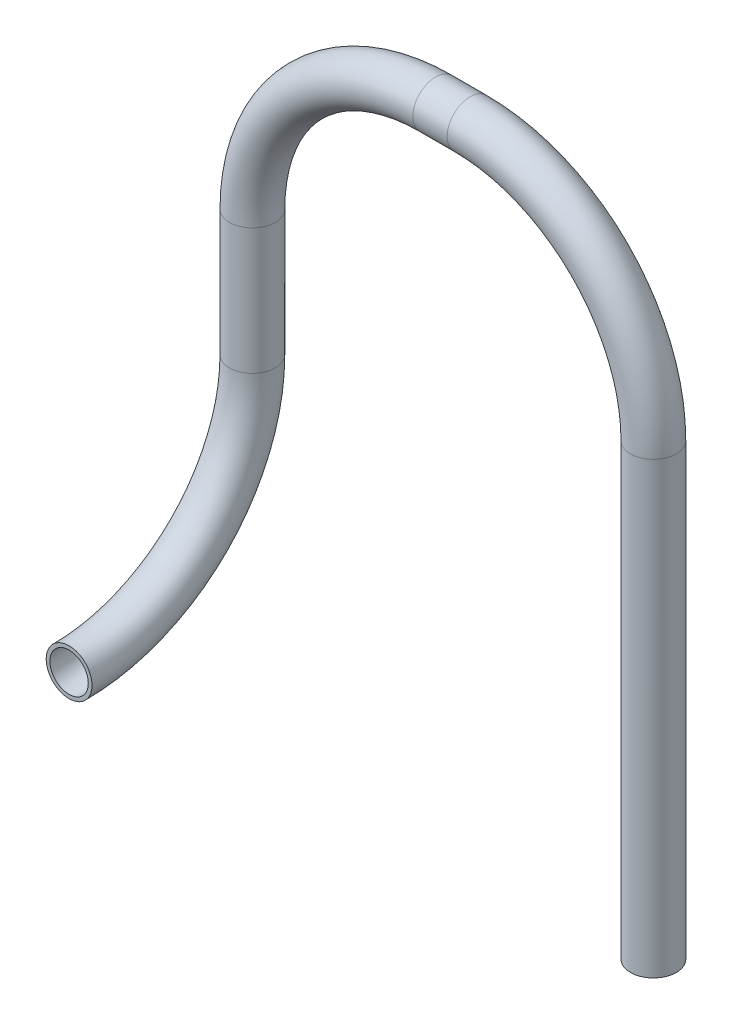
from build123d import *

# Parameters (mm, degrees)
SKETCH2_R     = 4
SKETCH2_R_2   = 3.35
SKETCH2_6_R   = 4
SKETCH2_6_R_2 = 3.35


with BuildPart() as part:
    # Sweep-Thin1: sweep along a path in Sketch1
    with BuildLine(Plane.XY) as sweep_thin1_path:
        Line((70, -56.4), (70, 22))
        ThreePointArc((70, 22), (60.627416998, 44.627416998), (38, 54))
        Line((38, 54), (32, 54))
        ThreePointArc((32, 54), (9.372583002, 44.627416998), (0, 22))
        Line((0, 22), (0, 0))
    # Sketch2 → Sweep-Thin1 (sweep)
    with BuildSketch(Plane(origin=(0, 0, 0), x_dir=(1, 0, 0), z_dir=(0, 1, 0))):
        Circle(SKETCH2_R)
        Circle(SKETCH2_R_2, mode=Mode.SUBTRACT)
    sweep(path=sweep_thin1_path.line)

    # Sweep-Thin2: sweep along a path in Sketch3
    with BuildLine(Plane(origin=(0, 0, 0), x_dir=(0, 0, -1), z_dir=(1, 0, 0))) as sweep_thin2_path:
        ThreePointArc((-32, -32), (-9.372583002, -22.627416998), (0, 0))
    # Sketch2<6> → Sweep-Thin2 (sweep)
    with BuildSketch(Plane(origin=(0, 0, 0), x_dir=(1, 0, 0), z_dir=(0, 1, 0))):
        Circle(SKETCH2_6_R)
        Circle(SKETCH2_6_R_2, mode=Mode.SUBTRACT)
    sweep(path=sweep_thin2_path.line)


solid = part.part
